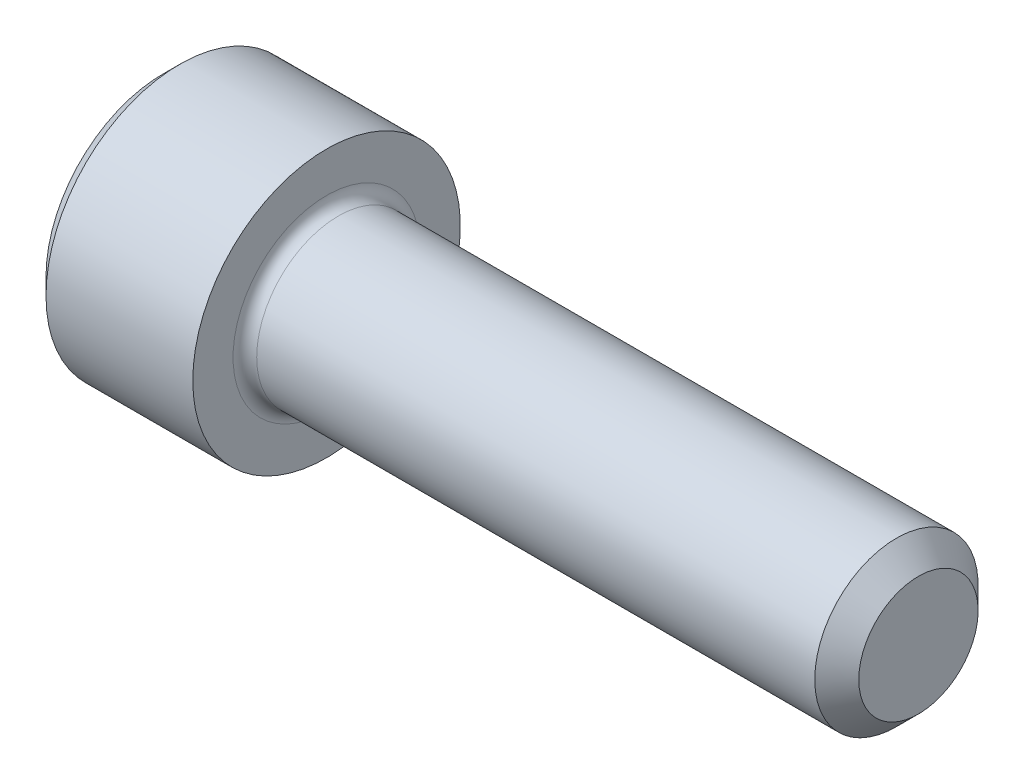
from build123d import *

# Parameters (mm, degrees)
FILLET1_R   = 0.254
HEX_2_DEPTH = 1.6256


with BuildPart() as part:
    # BodySke → Base-Revolve (revolve)
    with BuildSketch(Plane.XY):
        Polygon((0, 0), (0, 2.5146), (0.3556, 2.8702), (3.5052, 2.8702), (3.5052, 1.7526), (15.73276, 1.7526), (16.2052, 1.28016), (16.2052, 0), align=None)
    revolve(axis=Axis((-31.75, 0, 0), (1, 0, 0)))

    # Fillet1
    fillet1_edges = [part.edges().sort_by_distance(p)[0] for p in [
        (3.5052, -1.7526, 0),
    ]]
    fillet(fillet1_edges, radius=FILLET1_R)

    # Sketch2 → Hex-PreBroach (revolve, cut)
    with BuildSketch(Plane.XY):
        Polygon((0, 1.3843), (1.6256, 1.3843), (2.424825978, 0), (0, 0), align=None)
    revolve(axis=Axis((0, 0, 0), (1, 0, 0)), mode=Mode.SUBTRACT)

    # Sketch3 → Hex 2 (cut)
    with BuildSketch(Plane(origin=(0, 0, 0), x_dir=(0, 0.500000000000001, 0.866025403784438), z_dir=(-1, 0, 0))):
        Polygon((0.799225978, 1.3843), (-0.799225978, 1.3843), (-1.598451955, 0), (-0.799225978, -1.3843), (0.799225978, -1.3843), (1.598451955, 0), align=None)
    extrude(amount=-HEX_2_DEPTH, mode=Mode.SUBTRACT)


solid = part.part
